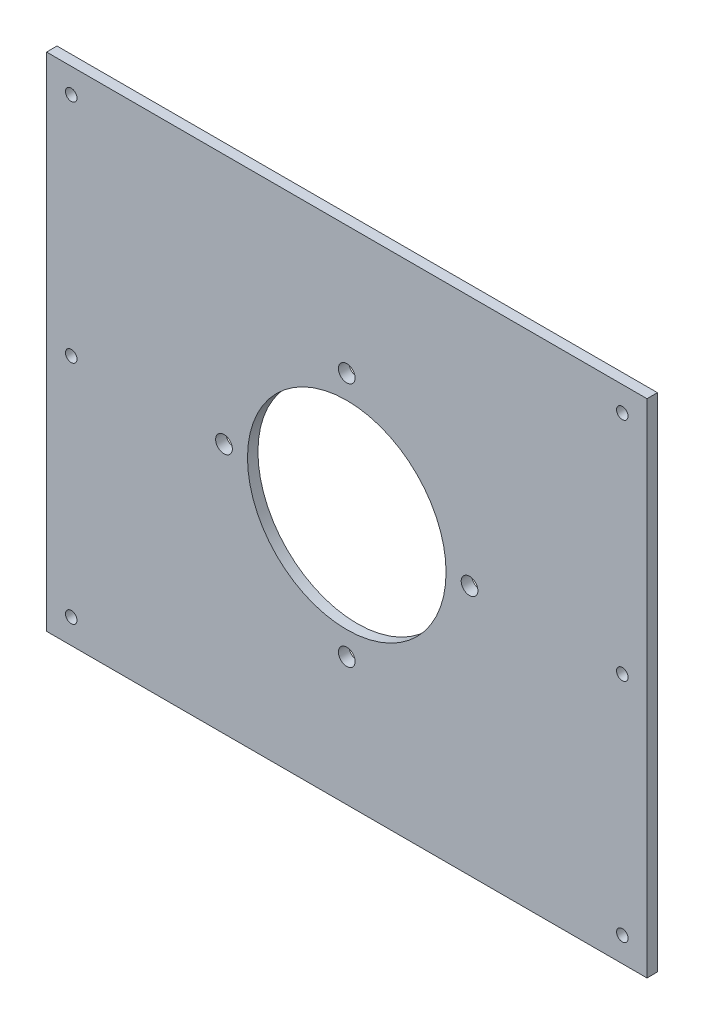
from build123d import *

# Parameters (mm, degrees)
SKETCH1_W           = 364.8
SKETCH1_H           = 304.8
SKETCH1_R           = 3.5
SKETCH1_R_2         = 5.08
SKETCH1_R_3         = 60.325
BOSS_EXTRUDE1_DEPTH = 6.35


with BuildPart() as part:
    # Sketch1 → Boss-Extrude1 (new body)
    with BuildSketch(Plane.XY):
        with Locations((102.199217301, 57.89924129)):
            Rectangle(SKETCH1_W, SKETCH1_H)
        with Locations((269.599217301, 195.29924129)):
            Circle(SKETCH1_R, mode=Mode.SUBTRACT)
        with Locations((102.199217301, 132.499241315)):
            Circle(SKETCH1_R_2, mode=Mode.SUBTRACT)
        with Locations((27.599217276, 57.89924129)):
            Circle(SKETCH1_R_2, mode=Mode.SUBTRACT)
        with Locations((-65.200782699, -79.50075871)):
            Circle(SKETCH1_R, mode=Mode.SUBTRACT)
        with Locations((-65.200782699, 57.89924129)):
            Circle(SKETCH1_R, mode=Mode.SUBTRACT)
        with Locations((-65.200782699, 195.29924129)):
            Circle(SKETCH1_R, mode=Mode.SUBTRACT)
        with Locations((102.199217301, -16.700758735)):
            Circle(SKETCH1_R_2, mode=Mode.SUBTRACT)
        with Locations((176.799217326, 57.89924129)):
            Circle(SKETCH1_R_2, mode=Mode.SUBTRACT)
        with Locations((269.599217301, -79.50075871)):
            Circle(SKETCH1_R, mode=Mode.SUBTRACT)
        with Locations((269.599217301, 57.89924129)):
            Circle(SKETCH1_R, mode=Mode.SUBTRACT)
        with Locations((102.199217301, 57.89924129)):
            Circle(SKETCH1_R_3, mode=Mode.SUBTRACT)
    extrude(amount=BOSS_EXTRUDE1_DEPTH)


solid = part.part
